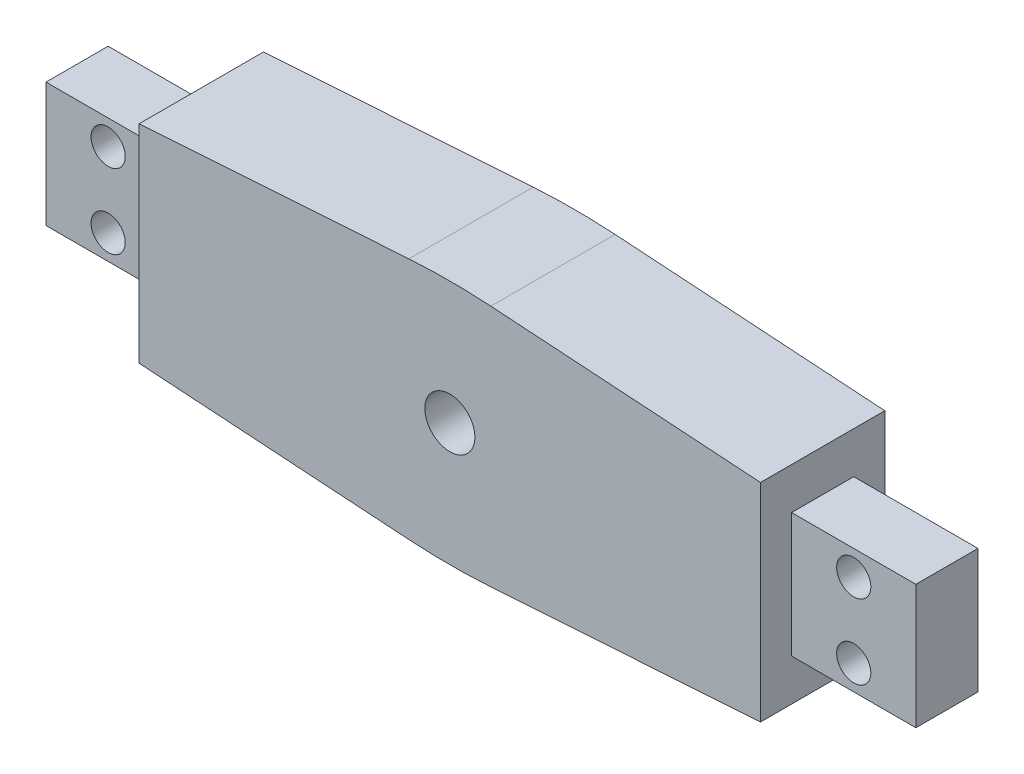
from build123d import *

# Parameters (mm, degrees)
SKETCH1_R           = 4.025
BOSS_EXTRUDE1_DEPTH = 20
FILLET1_R           = 100
SKETCH2_W           = 10
SKETCH2_H           = 20
BOSS_EXTRUDE2_DEPTH = 20
SKETCH3_R           = 2.75
CUT_EXTRUDE1_DEPTH  = 75.271947786


with BuildPart() as part:
    # Sketch1 → Boss-Extrude1 (new body)
    with BuildSketch(Plane.XY):
        Polygon((50, 16.695671227), (50, -16.695671227), (0, -20), (-50, -16.695671227), (-50, 16.695671227), (0, 20), align=None)
        Circle(SKETCH1_R, mode=Mode.SUBTRACT)
    extrude(amount=BOSS_EXTRUDE1_DEPTH)

    # Fillet1
    fillet1_edges = [part.edges().sort_by_distance(p)[0] for p in [
        (0, 20, 10),
        (0, -20, 10),
    ]]
    fillet(fillet1_edges, radius=FILLET1_R)

    # Sketch2 → Boss-Extrude2 (add)
    with BuildSketch(Plane(origin=(50, 0, 0), x_dir=(0, 0, -1), z_dir=(1, 0, 0))):
        with Locations((-10, 0)):
            Rectangle(SKETCH2_W, SKETCH2_H)
    boss_extrude2 = extrude(amount=BOSS_EXTRUDE2_DEPTH)

    # Mirror1: Boss-Extrude2 across plane
    add(boss_extrude2.mirror(Plane(origin=(0, 0, 0), x_dir=(0, 0, 1), z_dir=(1, 0, 0))))

    # Sketch3 → Cut-Extrude1 (cut, through all)
    with BuildSketch(Plane(origin=(0, 0, 5), x_dir=(-1, 0, 0), z_dir=(0, 0, -1))):
        with Locations((60, -6.000009749)):
            Circle(SKETCH3_R)
        with Locations((60, 5.999990251)):
            Circle(SKETCH3_R)
        with Locations((-60, -5.999990251)):
            Circle(SKETCH3_R)
        with Locations((-60, 6.000009749)):
            Circle(SKETCH3_R)
    extrude(amount=-CUT_EXTRUDE1_DEPTH, mode=Mode.SUBTRACT)


solid = part.part
